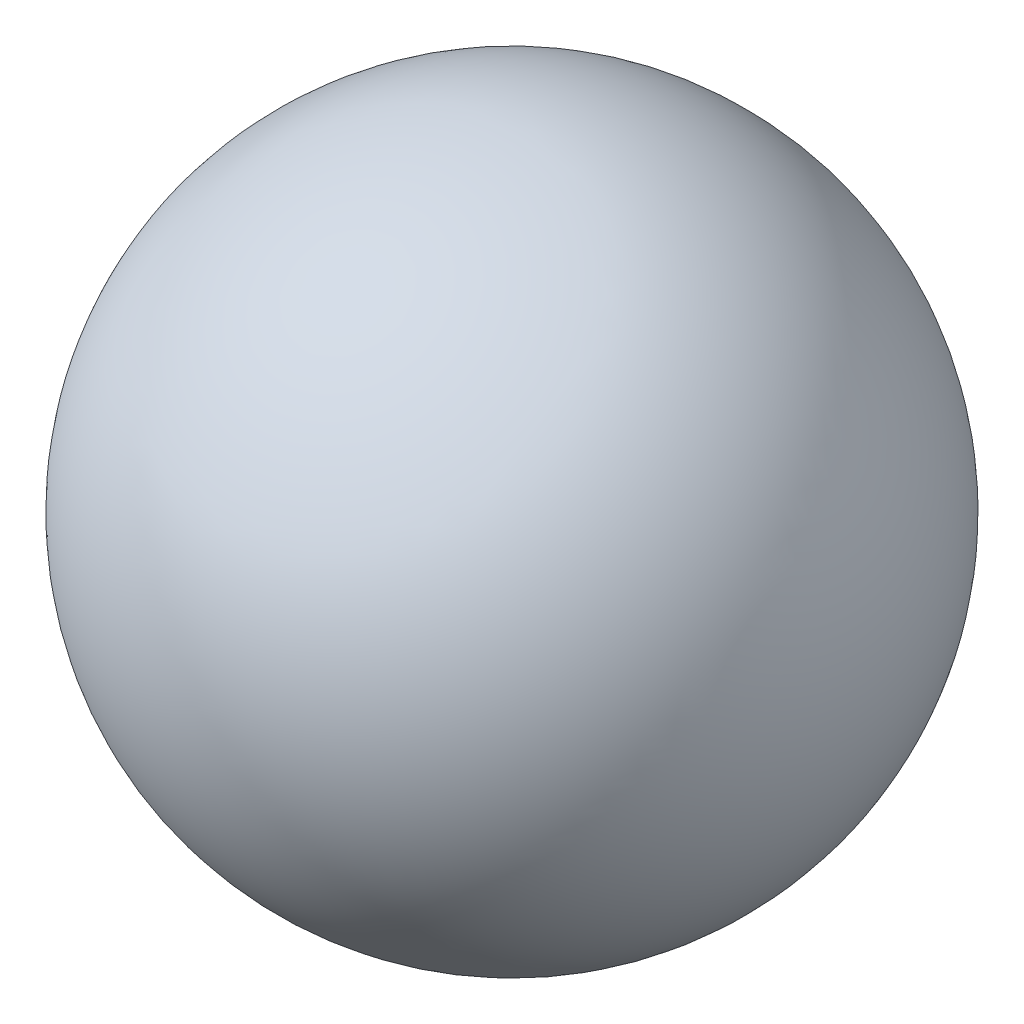
from build123d import *

# Parameters (mm, degrees)
SCALE1_SCALE = 1.5


with BuildPart() as part:
    # Sketch1 → Revolve1 (revolve)
    with BuildSketch(Plane.XY):
        with BuildLine():
            Line((-139.7, 0), (139.7, 0))
            ThreePointArc((139.7, 0), (0, -139.7), (-139.7, 0))
        make_face()
    revolve(axis=Axis((-139.7, 0, 0), (1, 0, 0)))


with BuildPart() as part_1:
    # Scale1: scaled about (0, 0, 0)
    add(part.part.scale(SCALE1_SCALE))


solid = part_1.part
